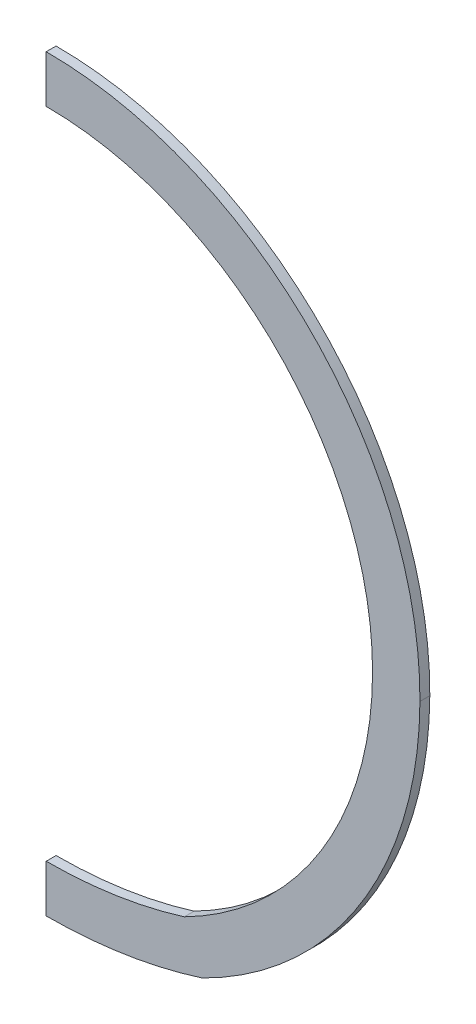
from build123d import *

# Parameters (mm, degrees)
BOSS_EXTRUDE1_DEPTH = 1.5875
SKETCH3_W           = 208.645691316
SKETCH3_H           = 383.026987577
CUT_EXTRUDE1_DEPTH  = 184.927178997


with BuildPart() as part:
    # Sketch2 → Boss-Extrude1 (new, symmetric)
    with BuildSketch(Plane.XY):
        with BuildLine():
            ThreePointArc((-120.098895727, 19.05), (0.406748907, 139.2017743), (120.203613722, 18.343301545))
            ThreePointArc((120.203613722, 18.343301545), (101.067699546, -47.629728931), (50.138751442, -93.726))
            ThreePointArc((50.138751442, -93.726), (0.040174098, -101.514794876), (-50.058403246, -93.726))
            ThreePointArc((-50.058403246, -93.726), (-101.163912713, -47.327889321), (-120.098895727, 19.05))
        make_face()
        with BuildLine():
            ThreePointArc((-104.858895727, 19.05), (0.361930242, 123.961840203), (104.963877332, 18.432938489))
            ThreePointArc((104.963877332, 18.432938489), (88.446745877, -39.065849025), (44.40486057, -79.553359885))
            ThreePointArc((44.40486057, -79.553359885), (0.040463589, -86.274794876), (-44.323959374, -79.553531384))
            ThreePointArc((-44.323959374, -79.553531384), (-88.517658334, -38.801393502), (-104.858895727, 19.05))
        make_face(mode=Mode.SUBTRACT)
    extrude(amount=BOSS_EXTRUDE1_DEPTH, both=True)

    # Sketch3 → Cut-Extrude1 (cut, through all)
    with BuildSketch(Plane(origin=(0, 0, 0), x_dir=(0, 0, -1), z_dir=(1, 0, 0))):
        with Locations((4.266053154, 20.866300598)):
            Rectangle(SKETCH3_W, SKETCH3_H)
    extrude(amount=-CUT_EXTRUDE1_DEPTH, mode=Mode.SUBTRACT)


solid = part.part
